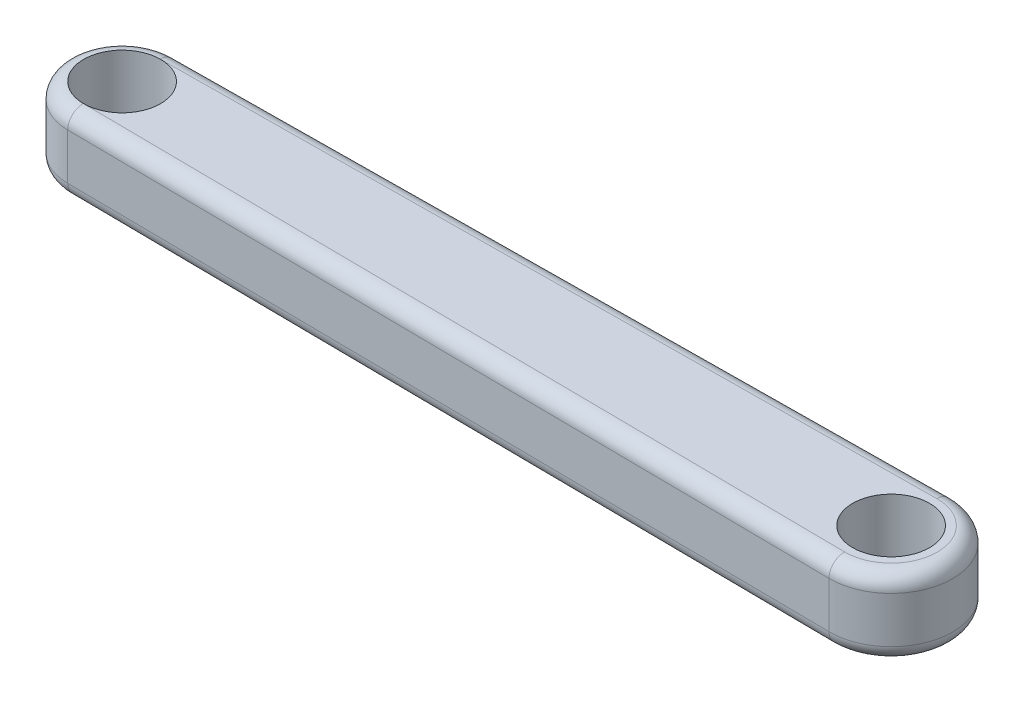
from build123d import *

# Parameters (mm, degrees)
CROQUIS1_R              = 25
SALIENTE_EXTRUIR1_DEPTH = 50
REDONDEO1_R             = 10


with BuildPart() as part:
    # Croquis1 → Saliente-Extruir1 (new body)
    with BuildSketch(Plane(origin=(0, 0, 0), x_dir=(1, 0, 0), z_dir=(0, 1, 0))):
        with BuildLine():
            Line((-150.35, 34.998249956), (349.6, 39.99799995))
            ThreePointArc((349.6, 39.99799995), (390, 0), (349.6, -39.99799995))
            Line((349.6, -39.99799995), (-150.35, -34.998249956))
            ThreePointArc((-150.35, -34.998249956), (-185, 0), (-150.35, 34.998249956))
        make_face()
        with Locations(Location((-150, 0, 0), (0, 0, 270))):
            Circle(CROQUIS1_R, mode=Mode.SUBTRACT)
        with Locations(Location((350, 0, 0), (0, 0, 270))):
            Circle(CROQUIS1_R, mode=Mode.SUBTRACT)
    extrude(amount=SALIENTE_EXTRUIR1_DEPTH)

    # Redondeo1
    redondeo1_edges = [part.edges().sort_by_distance(p)[0] for p in [
        (390, 50, 0),
        (99.625, 50, -37.498124953),
        (-185, 50, 0),
        (99.625, 0, -37.498124953),
        (390, 0, 0),
        (99.625, 0, 37.498124953),
        (-185, 0, 0),
        (99.625, 50, 37.498124953),
    ]]
    fillet(redondeo1_edges, radius=REDONDEO1_R - 0.0001)  # a hair under: the kernel refuses the full size


solid = part.part
